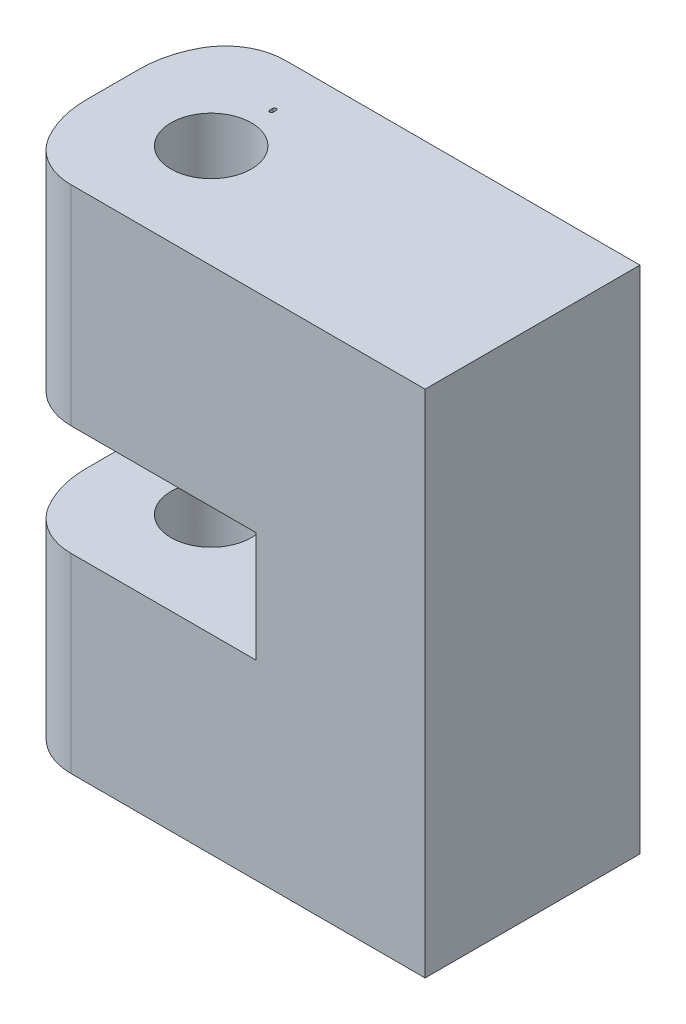
from build123d import *

# Parameters (mm, degrees)
BOSS_EXTRUDE4_DEPTH = 25.4
SKETCH3_R           = 2
CUT_EXTRUDE1_DEPTH  = 25.4
SKETCH5_W           = 54.299093249
SKETCH5_H           = 94.215662961
CUT_EXTRUDE2_DEPTH  = 4.5
SKETCH7_W           = 18.693193774
SKETCH7_H           = 5.5
CUT_EXTRUDE3_DEPTH  = 14.5
SKETCH9_W           = 36.111652001
SKETCH9_H           = 33.164105193
CUT_EXTRUDE4_DEPTH  = 1
SKETCH10_W          = 62.791660767
SKETCH10_H          = 37.243179947
CUT_EXTRUDE6_DEPTH  = 1
FILLET2_R           = 3
SKETCH11_W          = 10.7
SKETCH11_H          = 5.5
BOSS_EXTRUDE5_DEPTH = 2


with BuildPart() as part:
    # Sketch1 → Boss-Extrude4 (new body)
    with BuildSketch(Plane(origin=(0, 0, 0), x_dir=(1, 0, 0), z_dir=(0, 1, 0))):
        with BuildLine():
            ThreePointArc((-5.100024486, 5.049332428), (-3.343059972, 1.197813276), (0.717280831, 0))
            Line((0.717280831, 0), (20.32, 0))
            Line((20.32, 0), (20.32, 12.7))
            Line((20.32, 12.7), (0.98359831, 12.7))
            ThreePointArc((0.98359831, 12.7), (-3.239897706, 11.634417694), (-5.100024486, 7.695723417))
            Line((-5.100024486, 7.695723417), (-5.100024486, 5.049332428))
        make_face()
        with BuildLine():
            ThreePointArc((0.089422705, 9.167796597), (0, 9.078373892), (-0.089422705, 9.167796597))
            Line((-0.089422705, 9.167796597), (-0.089422705, 9.317189397))
            ThreePointArc((-0.089422705, 9.317189397), (0, 9.406612102), (0.089422705, 9.317189397))
            Line((0.089422705, 9.317189397), (0.089422705, 9.167796597))
        make_face(mode=Mode.SUBTRACT)
    extrude(amount=BOSS_EXTRUDE4_DEPTH)

    # Sketch3 → Cut-Extrude1 (cut)
    with BuildSketch(Plane(origin=(0, 25.4, 0), x_dir=(1, 0, 0), z_dir=(0, 1, 0))):
        with Locations((0, 6.163356084)):
            Circle(SKETCH3_R)
    extrude(amount=-CUT_EXTRUDE1_DEPTH, mode=Mode.SUBTRACT)

    # Sketch5 → Cut-Extrude2 (cut)
    with BuildSketch(Plane(origin=(20.32, 0, 0), x_dir=(0, 0, -1), z_dir=(1, 0, 0))):
        with Locations((11.125522758, -8.280714776)):
            Rectangle(SKETCH5_W, SKETCH5_H)
    extrude(amount=-CUT_EXTRUDE2_DEPTH, mode=Mode.SUBTRACT)

    # Sketch7 → Cut-Extrude3 (cut)
    with BuildSketch(Plane.ZY.offset(5.100024486)):
        with Locations((-6.318501351, 12.25)):
            Rectangle(SKETCH7_W, SKETCH7_H)
    extrude(amount=-CUT_EXTRUDE3_DEPTH, mode=Mode.SUBTRACT)

    # Sketch9 → Cut-Extrude4 (cut)
    with BuildSketch(Plane(origin=(0, 0, -12.7), x_dir=(-1, 0, 0), z_dir=(0, 0, -1))):
        with Locations((-4.511590843, 12.177462725)):
            Rectangle(SKETCH9_W, SKETCH9_H)
    extrude(amount=-CUT_EXTRUDE4_DEPTH, mode=Mode.SUBTRACT)


with BuildPart() as body_2:
    # of the pieces the cut leaves, the one that is kept (cut_extrude4_keep)
    add(part.part.solids().sort_by_distance((-3.158483624, 0, -11.7))[0])

    # Sketch10 → Cut-Extrude6 (cut)
    with BuildSketch(Plane.XY):
        with Locations((3.132657463, 10.976513171)):
            Rectangle(SKETCH10_W, SKETCH10_H)
    extrude(amount=-CUT_EXTRUDE6_DEPTH, mode=Mode.SUBTRACT)


with BuildPart() as body_2_2:
    # of the pieces the cut leaves, the one that is kept (cut_extrude6_keep)
    add(body_2.part.solids().sort_by_distance((-3.158483624, 0, -11.7))[0])

    # Fillet2
    fillet2_edges = [body_2_2.edges().sort_by_distance(p)[0] for p in [
        (-3.100509095, 4.75, -1),
        (-3.100509095, 20.2, -1),
        (-3.158483624, 20.2, -11.7),
        (-3.158483624, 4.75, -11.7),
    ]]
    fillet(fillet2_edges, radius=FILLET2_R)

    # Sketch11 → Boss-Extrude5 (add)
    with BuildSketch(Plane.ZY.offset(-9.399975514)):
        with Locations((-6.35, 12.25)):
            Rectangle(SKETCH11_W, SKETCH11_H)
    extrude(amount=BOSS_EXTRUDE5_DEPTH)


solid = body_2_2.part
